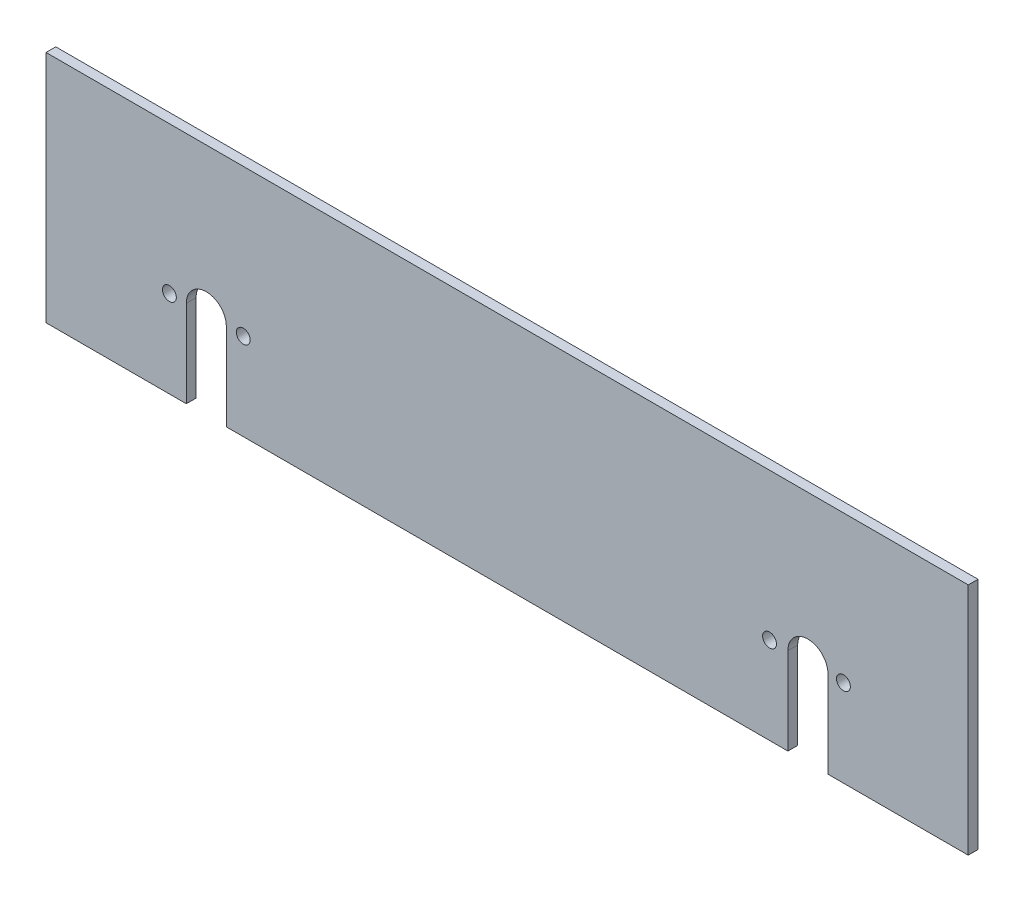
from build123d import *

# Parameters (mm, degrees)
SKETCH1_W            = 299.7
SKETCH1_H            = 76.075
BOSS_EXTRUDE1_DEPTH  = 3.175
CUT_EXTRUDE1_DEPTH   = 155.634907221
M4_CLEARANCE_HOLE1_D = 4.5


with BuildPart() as part:
    # Sketch1 → Boss-Extrude1 (new body)
    with BuildSketch(Plane.XY):
        Rectangle(SKETCH1_W, SKETCH1_H)
    extrude(amount=BOSS_EXTRUDE1_DEPTH)

    # Sketch3 → Cut-Extrude1 (cut, through all)
    with BuildSketch(Plane(origin=(0, 0, 0), x_dir=(-1, 0, 0), z_dir=(0, 0, -1))):
        with BuildLine():
            Line((-104.25, -38.0375), (-91.25, -38.0375))
            Line((-91.25, -38.0375), (-91.25, -9.7625))
            ThreePointArc((-91.25, -9.7625), (-97.75, -3.2625), (-104.25, -9.7625))
            Line((-104.25, -9.7625), (-104.25, -38.0375))
        make_face()
        with BuildLine():
            ThreePointArc((104.25, -9.7625), (97.75, -3.2625), (91.25, -9.7625))
            Line((91.25, -9.7625), (91.25, -38.0375))
            Line((91.25, -38.0375), (104.25, -38.0375))
            Line((104.25, -38.0375), (104.25, -9.7625))
        make_face()
    extrude(amount=-CUT_EXTRUDE1_DEPTH, mode=Mode.SUBTRACT)

    # M4 Clearance Hole1 (through all)
    with Locations(Plane(origin=(0, 0, 0), x_dir=(-1, 0, 0), z_dir=(0, 0, -1))):
        with Locations((-109.288, -9.7625), (-85.288, -9.7625), (85.75, -9.7625), (109.75, -9.7625)):
            Hole(M4_CLEARANCE_HOLE1_D / 2)


solid = part.part
